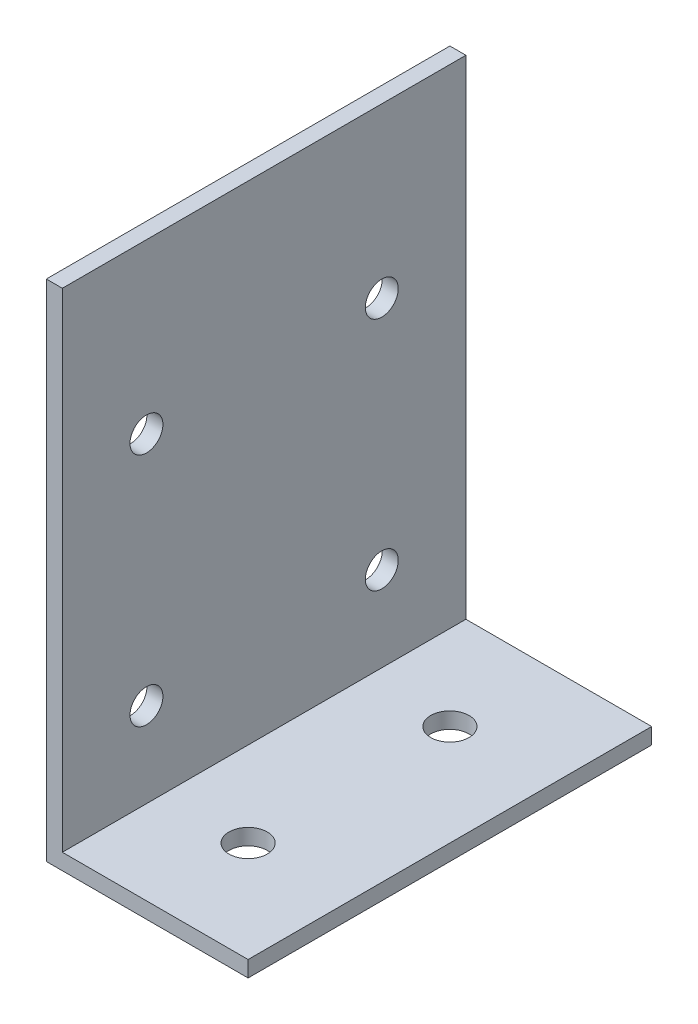
from build123d import *

# Parameters (mm, degrees)
BOSS_EXTRUDE1_DEPTH   = 20
F_4_CLEARANCE_HOLE1_D = 3.2639
F_6_CLEARANCE_HOLE1_D = 3.7973


with BuildPart() as part:
    # Sketch1 → Boss-Extrude1 (new body)
    with BuildSketch(Plane.XY):
        Polygon((0, 50), (0, 0), (20, 0), (20, 1.5875), (1.5875, 1.5875), (1.5875, 50), align=None)
    boss_extrude1 = extrude(amount=BOSS_EXTRUDE1_DEPTH)

    # #4 Clearance Hole1 (through all)
    with Locations(Plane.ZY):
        with Locations((11.6625, 33.325), (11.6625, 10)):
            f_4_clearance_hole1 = Hole(F_4_CLEARANCE_HOLE1_D / 2)

    # #6 Clearance Hole1 (through all)
    with Locations(Plane(origin=(10, 0, 10), x_dir=(0, 0, -1), z_dir=(0, -1, 0))):
        with Locations((0, 0)):
            f_6_clearance_hole1 = Hole(F_6_CLEARANCE_HOLE1_D / 2)

    # Mirror1: Boss-Extrude1, #4 Clearance Hole1, #6 Clearance Hole1 across plane
    add(boss_extrude1.mirror(Plane(origin=(0, 0, 0), x_dir=(1, 0, 0), z_dir=(0, 0, -1))))
    add(f_4_clearance_hole1.mirror(Plane(origin=(0, 0, 0), x_dir=(1, 0, 0), z_dir=(0, 0, -1))), mode=Mode.SUBTRACT)
    add(f_6_clearance_hole1.mirror(Plane(origin=(0, 0, 0), x_dir=(1, 0, 0), z_dir=(0, 0, -1))), mode=Mode.SUBTRACT)


solid = part.part
